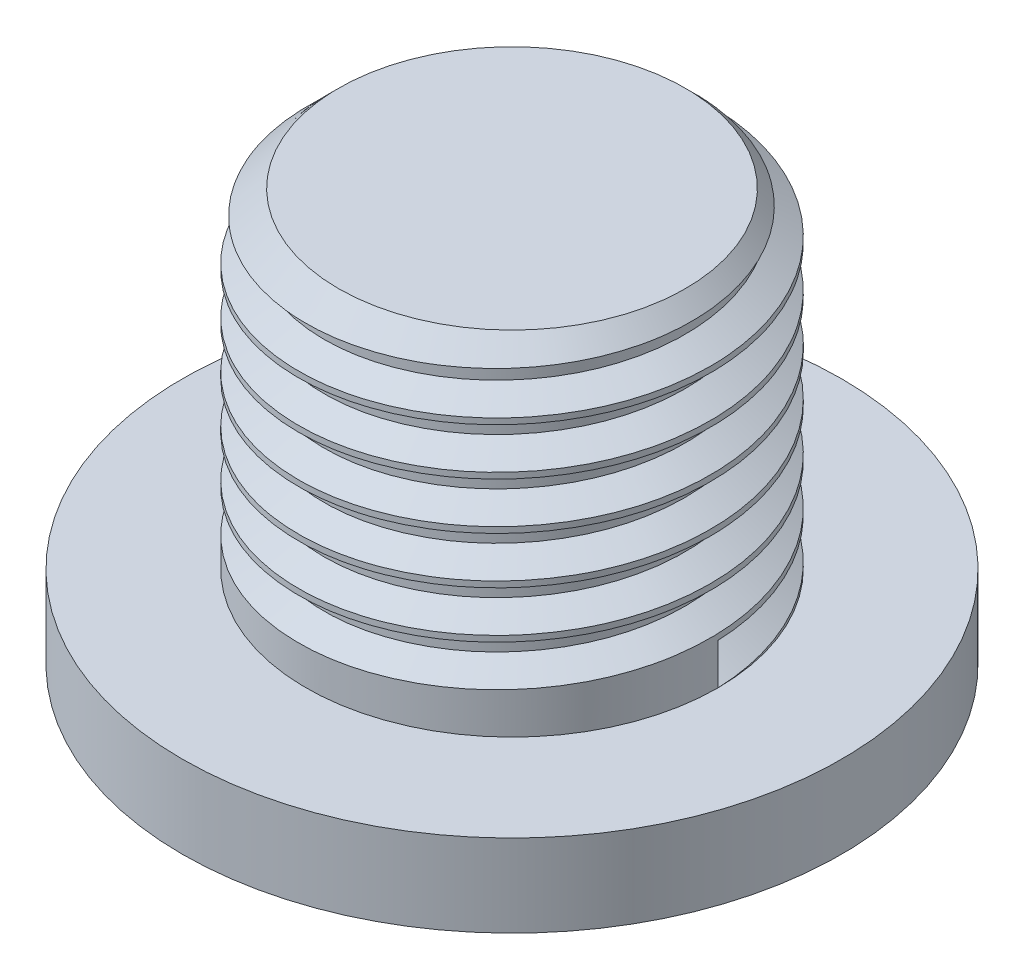
from build123d import *
from build123d.topology import SkipClean

# Parameters (mm, degrees)
SKETCH2_R           = 15.875
BOSS_EXTRUDE1_DEPTH = 25.4
SKETCH2_3_R         = 25.4
SKETCH2_3_R_2       = 15.875
BOSS_EXTRUDE2_DEPTH = 6.35
CUT_EXTRUDE2_DEPTH  = 7
CHAMFER1_SIZE       = 2.5
THREAD1_PITCH       = 3.628571429


with BuildPart() as part:
    # Sketch2 → Boss-Extrude1 (new body)
    with BuildSketch(Plane(origin=(0, 0, 0), x_dir=(1, 0, 0), z_dir=(0, 1, 0))):
        with Locations(Location((0, 0, 0), (0, 0, 270))):
            Circle(SKETCH2_R)
    extrude(amount=BOSS_EXTRUDE1_DEPTH)


with BuildPart() as body_2:
    # Sketch2<3> → Boss-Extrude2 (new body)
    # profile 1 of 2: a face of its own
    with BuildSketch(Plane(origin=(0, 0, 0), x_dir=(1, 0, 0), z_dir=(0, 1, 0))):
        with Locations(Location((0, 0, 0), (0, 0, 270))):
            Circle(SKETCH2_3_R)
        with Locations(Location((0, 0, 0), (0, 0, 270))):
            Circle(SKETCH2_3_R_2, mode=Mode.SUBTRACT)
    # profile 2 of 2: a face of its own
    with BuildSketch(Plane(origin=(0, 0, 0), x_dir=(1, 0, 0), z_dir=(0, 1, 0))):
        with Locations(Location((0, 0, 0), (0, 0, 270))):
            Circle(SKETCH2_3_R_2)
    extrude(amount=-BOSS_EXTRUDE2_DEPTH)


with BuildPart() as cut_extrude2_tool:
    # Sketch4 → Cut-Extrude2 (new body)
    with BuildSketch(Plane.XZ.offset(6.35)):
        Polygon((0, -9.237604307), (8, -4.618802154), (8, 4.618802154), (0, 9.237604307), (-8, 4.618802154), (-8, -4.618802154), align=None)
    extrude(amount=-CUT_EXTRUDE2_DEPTH)


with BuildPart() as part_1:
    add(part.part)

    # Cut-Extrude2: cut by cut_extrude2_tool
    add(cut_extrude2_tool.part, mode=Mode.SUBTRACT)

    # Chamfer1
    chamfer1_edges = [part_1.edges().sort_by_distance(p)[0] for p in [
        (0, 25.4, -15.875),
    ]]
    chamfer(chamfer1_edges, length=CHAMFER1_SIZE)

    # Thread1: the profile of Thread Profile1 profile screwed along a right-hand helix of 7 turns, 12 arcs to a turn; built about Z, then put on its axis
    with SkipClean():  # the faces are left unmerged after this step: merging them gives an invalid solid
        thread1_z = Axis((0, 0, 0), (0, 0, 1))
        thread1_corners = [(15.8753, 0, -0.000173205), (15.8753, 0, 3.175173195), (13.910978111, 0, 2.041071424), (13.910978111, 0, 1.133928566)]
        with BuildLine(mode=Mode.PRIVATE) as thread1_profile:
            Line(thread1_corners[0], thread1_corners[1])
            Line(thread1_corners[1], thread1_corners[2])
            Line(thread1_corners[2], thread1_corners[3])
            Line(thread1_corners[3], thread1_corners[0])
        thread1_cap = Face(thread1_profile.wire())
        thread1_turn_angles = [0, 15, 30, 45, 60, 75, 90, 105, 120, 135, 150, 165, 180, 195, 210, 225, 240, 255, 270, 285, 300, 315, 330, 345, 360]
        thread1_turn_weights = [1, 0.9659258262890683, 1, 0.9659258262890683, 1, 0.9659258262890683, 1, 0.9659258262890683, 1, 0.9659258262890683, 1, 0.9659258262890683, 1, 0.9659258262890683, 1, 0.9659258262890683, 1, 0.9659258262890683, 1, 0.9659258262890683, 1, 0.9659258262890683, 1, 0.9659258262890683, 1]
        thread1_turn_rails = [Edge.make_bspline([Vector(p[0], p[1], 0).rotate(thread1_z, thread1_turn_angles[k]) / thread1_turn_weights[k] + Vector(0, 0, p[2] + THREAD1_PITCH * thread1_turn_angles[k] / 360) for k in range(25)], [0, 0, 0, 1, 1, 2, 2, 3, 3, 4, 4, 5, 5, 6, 6, 7, 7, 8, 8, 9, 9, 10, 10, 11, 11, 12, 12, 12], 2, thread1_turn_weights) for p in thread1_corners]
        thread1_turn_sides = [Face.make_surface_from_curves(thread1_turn_rails[p[0]], thread1_turn_rails[p[1]]) for p in [(0, 1), (1, 2), (2, 3), (3, 0)]]
        thread1 = Plane(origin=(0, 0, 0), x_dir=(1, 0, 0), z_dir=(0, 1, 0)) * Solid(Shell([*[p.moved(Location((0, 0, THREAD1_PITCH * i))) for i in range(7) for p in thread1_turn_sides], thread1_cap, thread1_cap.rotate(thread1_z, 2520).moved(Location((0, 0, THREAD1_PITCH * 2520 / 360)))]))
        add(thread1, mode=Mode.SUBTRACT)


with BuildPart() as body_2_1:
    add(body_2.part)

    # Cut-Extrude2: cut by cut_extrude2_tool
    add(cut_extrude2_tool.part, mode=Mode.SUBTRACT)


solid = Compound([part_1.part, body_2_1.part])
